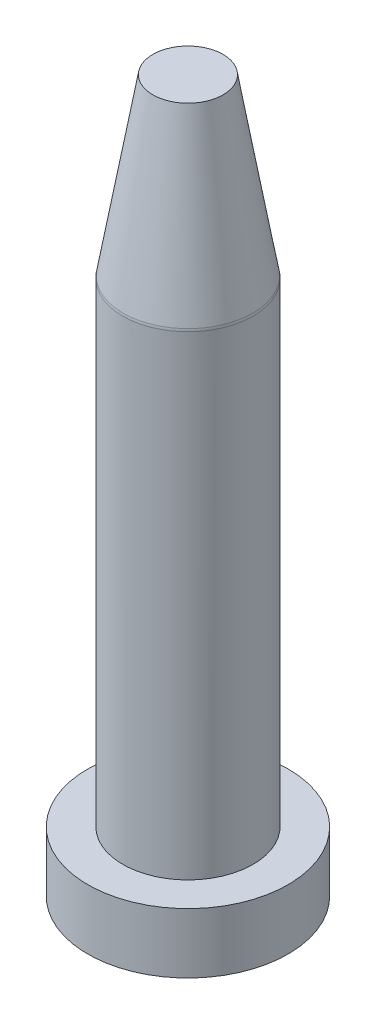
from build123d import *

# Parameters (mm, degrees)
FILLET_1_R = 3


with BuildPart() as part:
    # 草图1 → Revolve 297 (revolve)
    with BuildSketch(Plane.XY):
        Polygon((0, 0), (20, 0), (20, 12), (13, 12), (13, 107), (7, 142), (0, 142), align=None)
    revolve(axis=Axis((0, 0, 0), (0, 1, 0)))

    # 圆角1
    fillet_1_edges = [part.edges().sort_by_distance(p)[0] for p in [
        (-13, 107, 0),
    ]]
    fillet(fillet_1_edges, radius=FILLET_1_R)


solid = part.part
